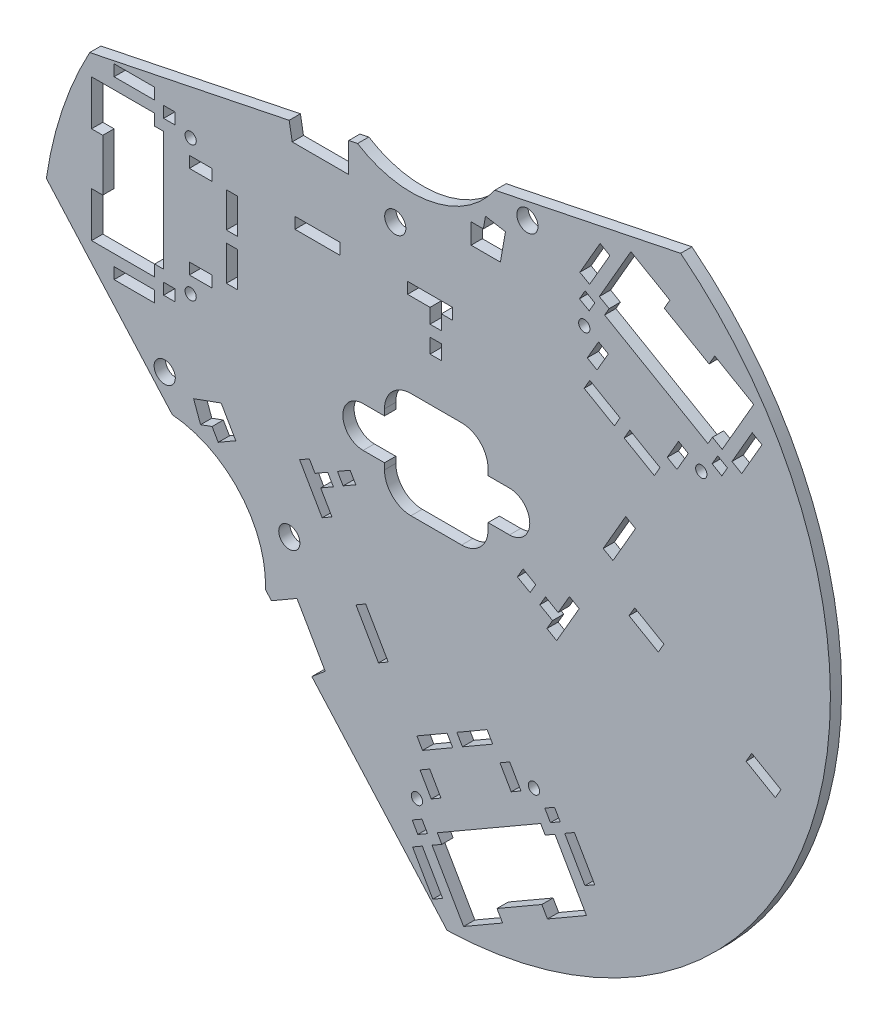
from build123d import *

# Parameters (mm, degrees)
ESQUISSE1_R             = 175
BOSS_EXTRU_1_DEPTH      = 5
ESQUISSE2_W             = 5
ESQUISSE2_H             = 6.5
ESQUISSE2_W_2           = 20
ESQUISSE2_H_2           = 5
ESQUISSE2_H_3           = 15.5
ESQUISSE2_W_3           = 10
ESQUISSE2_W_4           = 18
ESQUISSE2_H_4           = 20
ENL_V_MAT_EXTRU_1_DEPTH = 5
ENL_V_MAT_EXTRU_2_DEPTH = 5
ESQUISSE4_R             = 2.5
ENL_V_MAT_EXTRU_3_DEPTH = 5
ESQUISSE5_R             = 4.7
ENL_V_MAT_EXTRU_4_DEPTH = 5
BOSS_EXTRU_2_DEPTH      = 5
ENL_V_MAT_EXTRU_5_DEPTH = 5
ENL_V_MAT_EXTRU_6_DEPTH = 10


with BuildPart() as part:
    # Esquisse1 → Boss.-Extru.1 (new body)
    with BuildSketch(Plane.XY):
        with Locations((148.080426897, -12.110171348)):
            Circle(ESQUISSE1_R)
    extrude(amount=BOSS_EXTRU_1_DEPTH)

    # Esquisse2 → Enlèv. mat.-Extru.1 (cut)
    with BuildSketch(Plane(origin=(0, 0, 0), x_dir=(-1, 0, 0), z_dir=(0, 0, -1))):
        Polygon((-155.311788567, 53.777441362), (-135.311788567, 53.777441362), (-135.311788567, 48.777441362), (-145.311788567, 48.777441362), (-145.311788567, 42.277441362), (-150.311788567, 42.277441362), (-150.311788567, 48.777441362), (-155.311788567, 48.777441362), align=None)
        with Locations((-147.811788567, 34.027441362)):
            Rectangle(ESQUISSE2_W, ESQUISSE2_H)
        with Locations((-95.311788567, 51.277441362)):
            Rectangle(ESQUISSE2_W_2, ESQUISSE2_H_2)
        with Locations((-57.36, 41.027441362)):
            Rectangle(ESQUISSE2_W, ESQUISSE2_H_3)
        with Locations((-57.36, 20.527441362)):
            Rectangle(ESQUISSE2_W, ESQUISSE2_H_3)
        with Locations((-43.43, 10.277441362)):
            Rectangle(ESQUISSE2_W_3, ESQUISSE2_H_2)
        with Locations((-29.5, -3.222558638)):
            Rectangle(ESQUISSE2_W, ESQUISSE2_H_2)
        with Locations((-14, -8.222558638)):
            Rectangle(ESQUISSE2_W_4, ESQUISSE2_H_2)
        with Locations((2.5, 9.277441362)):
            Rectangle(ESQUISSE2_W, ESQUISSE2_H_4)
        with Locations((2.5, 52.277441362)):
            Rectangle(ESQUISSE2_W, ESQUISSE2_H_4)
        with Locations((-14, 69.777441362)):
            Rectangle(ESQUISSE2_W_4, ESQUISSE2_H_2)
        with Locations((-29.5, 64.777441362)):
            Rectangle(ESQUISSE2_W, ESQUISSE2_H_2)
        with Locations((-43.43, 51.277441362)):
            Rectangle(ESQUISSE2_W_3, ESQUISSE2_H_2)
        Polygon((-87.404399659, -38.791434793), (-97.404399659, -56.111942869), (-101.734526678, -53.611942869), (-96.734526678, -44.951688831), (-102.363691803, -41.701688831), (-99.863691803, -37.371561812), (-94.234526678, -40.621561812), (-91.734526678, -36.291434793), align=None)
        Polygon((-104.193818822, -34.871561812), (-106.693818822, -39.201688831), (-112.322983946, -35.951688831), (-109.822983946, -31.621561812), align=None)
        Polygon((-112.404399659, -82.092704982), (-122.404399659, -99.413213058), (-126.734526678, -96.913213058), (-116.734526678, -79.592704982), align=None)
        Polygon((-139.460420962, -118.955108529), (-141.960420962, -123.285235548), (-155.38381472, -115.535235548), (-152.88381472, -111.205108529), align=None)
        Polygon((-157.213941739, -108.705108529), (-159.713941739, -113.035235548), (-173.137335498, -105.285235548), (-170.637335498, -100.955108529), align=None)
        Polygon((-176.352335498, -110.853778894), (-181.352335498, -119.514032932), (-185.682462517, -117.014032932), (-180.682462517, -108.353778894), align=None)
        Polygon((-196.258678449, -118.332576278), (-198.758678449, -122.662703297), (-203.088805468, -120.162703297), (-200.588805468, -115.832576278), align=None)
        Polygon((-205.088805468, -123.626804912), (-214.088805468, -139.215262181), (-218.418932487, -136.715262181), (-209.418932487, -121.126804912), align=None)
        Polygon((-212.258678449, -146.045389199), (-214.758678449, -150.375516218), (-197.438170373, -160.375516218), (-194.938170373, -156.045389199), align=None)
        Polygon((-175.019586086, -167.545389199), (-177.519586086, -171.875516218), (-160.199078011, -181.875516218), (-157.699078011, -177.545389199), align=None)
        Polygon((-141.868950992, -160.126804912), (-150.868950992, -175.715262181), (-146.538823973, -178.215262181), (-137.538823973, -162.626804912), align=None)
        Polygon((-139.868950992, -156.662703297), (-137.368950992, -152.332576278), (-141.699078011, -149.832576278), (-144.199078011, -154.162703297), align=None)
        Polygon((-145.845293943, -140.014032932), (-140.845293943, -131.353778894), (-145.175420962, -128.853778894), (-150.175420962, -137.514032932), align=None)
        Polygon((-201.525092463, -51.316520615), (-211.525092463, -33.996012539), (-207.194965444, -31.496012539), (-202.194965444, -40.156266577), (-196.56580032, -36.906266577), (-194.06580032, -41.236393596), (-199.694965444, -44.486393596), (-197.194965444, -48.816520615), align=None)
        Polygon((-189.735673301, -38.736393596), (-192.235673301, -34.406266577), (-186.606508176, -31.156266577), (-184.106508176, -35.486393596), align=None)
        Polygon((-226.525092463, -8.015250425), (-236.525092463, 9.30525765), (-232.194965444, 11.80525765), (-222.194965444, -5.515250425), align=None)
        Polygon((-244.920859728, 33.847153121), (-247.420859728, 38.17728014), (-233.997465969, 45.92728014), (-231.497465969, 41.597153121), align=None)
        Polygon((-227.16733895, 44.097153121), (-229.66733895, 48.42728014), (-216.243945192, 56.17728014), (-213.743945192, 51.847153121), align=None)
        Polygon((-219.458945192, 61.745823487), (-224.458945192, 70.406077524), (-220.128818173, 72.906077524), (-215.128818173, 64.245823487), align=None)
        Polygon((-215.982602241, 82.724620871), (-218.482602241, 87.05474789), (-214.152475222, 89.55474789), (-211.652475222, 85.224620871), align=None)
        Polygon((-216.152475222, 93.018849505), (-225.152475222, 108.607306773), (-220.822348203, 111.107306773), (-211.822348203, 95.518849505), align=None)
        Polygon((-231.982602241, 110.437433792), (-234.482602241, 114.767560811), (-251.803110316, 104.767560811), (-249.303110316, 100.437433792), align=None)
        Polygon((-269.221694603, 88.937433792), (-271.721694603, 93.267560811), (-289.042202679, 83.267560811), (-286.542202679, 78.937433792), align=None)
        Polygon((-279.372329698, 56.518849505), (-288.372329698, 72.107306773), (-292.702456717, 69.607306773), (-283.702456717, 54.018849505), align=None)
        Polygon((-277.372329698, 53.05474789), (-274.872329698, 48.724620871), (-270.542202679, 51.224620871), (-273.042202679, 55.55474789), align=None)
        Polygon((-259.965986747, 49.906077524), (-254.965986747, 41.245823487), (-250.635859728, 43.745823487), (-255.635859728, 52.406077524), align=None)
    extrude(amount=-ENL_V_MAT_EXTRU_1_DEPTH, mode=Mode.SUBTRACT)

    # Esquisse3 → Enlèv. mat.-Extru.2 (cut)
    with BuildSketch(Plane(origin=(0, 0, 0), x_dir=(-1, 0, 0), z_dir=(0, 0, -1))):
        Polygon((0, -0.722558638), (-23, -0.722558638), (-23, 4.277441362), (-27, 4.277441362), (-27, 57.277441362), (-23, 57.277441362), (-23, 62.277441362), (0, 62.277441362), align=None)
        Polygon((-212.258678449, -146.045389199), (-200.758678449, -126.126804912), (-196.42855143, -128.626804912), (-194.42855143, -125.162703297), (-148.52920503, -151.662703297), (-150.52920503, -155.126804912), (-146.199078011, -157.626804912), (-157.699078011, -177.545389199), align=None)
        Polygon((-231.982602241, 110.437433792), (-220.482602241, 90.518849505), (-224.81272926, 88.018849505), (-222.81272926, 84.55474789), (-268.71207566, 58.05474789), (-270.71207566, 61.518849505), (-275.042202679, 59.018849505), (-286.542202679, 78.937433792), align=None)
    extrude(amount=-ENL_V_MAT_EXTRU_2_DEPTH, mode=Mode.SUBTRACT)

    # Esquisse4 → Enlèv. mat.-Extru.3 (cut)
    with BuildSketch(Plane(origin=(0, 0, 0), x_dir=(-1, 0, 0), z_dir=(0, 0, -1))):
        with Locations((-39, 60.777441362)):
            Circle(ESQUISSE4_R)
        with Locations((-39, 0.777441362)):
            Circle(ESQUISSE4_R)
        with Locations((-139.498116116, -143.020398452)):
            Circle(ESQUISSE4_R)
        with Locations((-191.459640343, -113.020398452)):
            Circle(ESQUISSE4_R)
        with Locations((-265.743164573, 45.912443044)):
            Circle(ESQUISSE4_R)
        with Locations((-213.781640346, 75.912443044)):
            Circle(ESQUISSE4_R)
    extrude(amount=-ENL_V_MAT_EXTRU_3_DEPTH, mode=Mode.SUBTRACT)

    # Esquisse5 → Enlèv. mat.-Extru.4 (cut)
    with BuildSketch(Plane(origin=(0, 0, 0), x_dir=(-1, 0, 0), z_dir=(0, 0, -1))):
        with Locations((-188.54080573, 103.777441362)):
            Circle(ESQUISSE5_R)
        with Locations((-129.859999997, 73.777441362)):
            Circle(ESQUISSE5_R)
        with Locations((-27.488620889, -35.014261787)):
            Circle(ESQUISSE5_R)
        with Locations((-82.809785869, -70.833330267)):
            Circle(ESQUISSE5_R)
        Polygon((9.512961524, 70.443622585), (-93.474910733, 91.632672923), (-94.859999997, 83.777441362), (-174.859999997, 83.777441362), (-179.360865983, 109.303120805), (-315.699146075, 137.353789457), (-290.786999001, 258.437508623), (34.425108598, 191.527341751), align=None)
        Polygon((-233.671367804, -25.637538451), (-246.66174886, -33.137538451), (-249.16174886, -28.807411432), (-236.171367804, -21.307411432), align=None)
        Polygon((-155.383438382, -189.866946156), (-85.539246378, -111.271357669), (-91.649531831, -106.144219399), (-51.649531831, -36.862187096), (-27.293211991, -45.727162534), (65.168519701, 58.319917207), (157.574022946, -23.796494605), (-62.977935137, -271.983357968), align=None)
        Polygon((-285.632892031, -55.637538451), (-298.623273088, -63.137538451), (-301.123273088, -58.807411432), (-288.132892031, -51.307411432), align=None)
    extrude(amount=-ENL_V_MAT_EXTRU_4_DEPTH, mode=Mode.SUBTRACT)

    # Esquisse6 → Boss.-Extru.2 (add)
    with BuildSketch(Plane(origin=(0, 0, 0), x_dir=(-1, 0, 0), z_dir=(0, 0, -1))):
        with BuildLine():
            Line((-72.219328665, -96.282469671), (-85.539246378, -111.271357669))
            Line((-85.539246378, -111.271357669), (-94.478128434, -107.364683264))
            Line((-94.478128434, -107.364683264), (-52.020767653, -31.413182311))
            Line((-52.020767653, -31.413182311), (-27.293211991, -45.727162534))
            Line((-27.293211991, -45.727162534), (-30.866030993, -49.747651624))
            ThreePointArc((-30.866030993, -49.747651624), (-60.888072009, -64.710251454), (-72.219328665, -96.282469671))
        make_face()
        with BuildLine():
            Line((-113.11562737, 95.67361604), (-93.474910733, 91.632672923))
            Line((-93.474910733, 91.632672923), (-92.388748984, 81.938036779))
            Line((-92.388748984, 81.938036779), (-179.393358655, 80.731439317))
            Line((-179.393358655, 80.731439317), (-179.360865983, 109.303120805))
            Line((-179.360865983, 109.303120805), (-174.092610795, 108.219213332))
            ThreePointArc((-174.092610795, 108.219213332), (-146.123598727, 89.700663053), (-113.11562737, 95.67361604))
        make_face()
    extrude(amount=-BOSS_EXTRU_2_DEPTH)

    # Esquisse7 → Enlèv. mat.-Extru.5 (cut)
    with BuildSketch(Plane(origin=(0, 0, 0), x_dir=(-1, 0, 0), z_dir=(0, 0, -1))):
        Polygon((-109.197691521, 94.867527535), (-109.197691521, 81.777441362), (-84.10034763, 81.777441362), (-82.751624535, 89.426430129), align=None)
        Polygon((-74.876389713, -99.272457394), (-86.212736876, -92.727414308), (-98.761408822, -114.462351685), (-92.811551784, -119.454874531), align=None)
        Polygon((-163.538199262, 81.777441362), (-176.538199262, 81.777441362), (-178.795625572, 94.579942151), (-169.932355795, 96.14277575), (-168.986302582, 90.777441362), (-163.538199262, 90.777441362), align=None)
        Polygon((-59.042483006, -45.667154149), (-52.542483006, -34.4088239), (-40.326478935, -38.855085763), (-43.404660225, -47.31231935), (-48.524202712, -45.448958272), (-51.248254372, -50.167154149), align=None)
    extrude(amount=-ENL_V_MAT_EXTRU_5_DEPTH, mode=Mode.SUBTRACT)

    # Esquisse9 → Enlèv. mat.-Extru.6 (cut)
    with BuildSketch(Plane.XY.offset(5)):
        with BuildLine():
            Line((180.580426897, -21.110171348), (171.080426897, -21.110171348))
            Line((171.080426897, -21.110171348), (171.080426897, -23.860171348))
            ThreePointArc((171.080426897, -23.860171348), (167.638931576, -32.168676027), (159.330426897, -35.610171348))
            Line((159.330426897, -35.610171348), (136.830426897, -35.610171348))
            ThreePointArc((136.830426897, -35.610171348), (128.521922218, -32.168676027), (125.080426897, -23.860171348))
            Line((125.080426897, -23.860171348), (125.080426897, -21.110171348))
            Line((125.080426897, -21.110171348), (115.580426897, -21.110171348))
            ThreePointArc((115.580426897, -21.110171348), (106.580426897, -12.110171348), (115.580426897, -3.110171348))
            Line((115.580426897, -3.110171348), (125.080426897, -3.110171348))
            Line((125.080426897, -3.110171348), (125.080426897, -0.360171348))
            ThreePointArc((125.080426897, -0.360171348), (128.521922218, 7.94833333), (136.830426897, 11.389828652))
            Line((136.830426897, 11.389828652), (159.330426897, 11.389828652))
            ThreePointArc((159.330426897, 11.389828652), (167.638931576, 7.94833333), (171.080426897, -0.360171348))
            Line((171.080426897, -0.360171348), (171.080426897, -3.110171348))
            Line((171.080426897, -3.110171348), (180.580426897, -3.110171348))
            ThreePointArc((180.580426897, -3.110171348), (189.580426897, -12.110171348), (180.580426897, -21.110171348))
        make_face()
    extrude(amount=-ENL_V_MAT_EXTRU_6_DEPTH, mode=Mode.SUBTRACT)


solid = part.part
